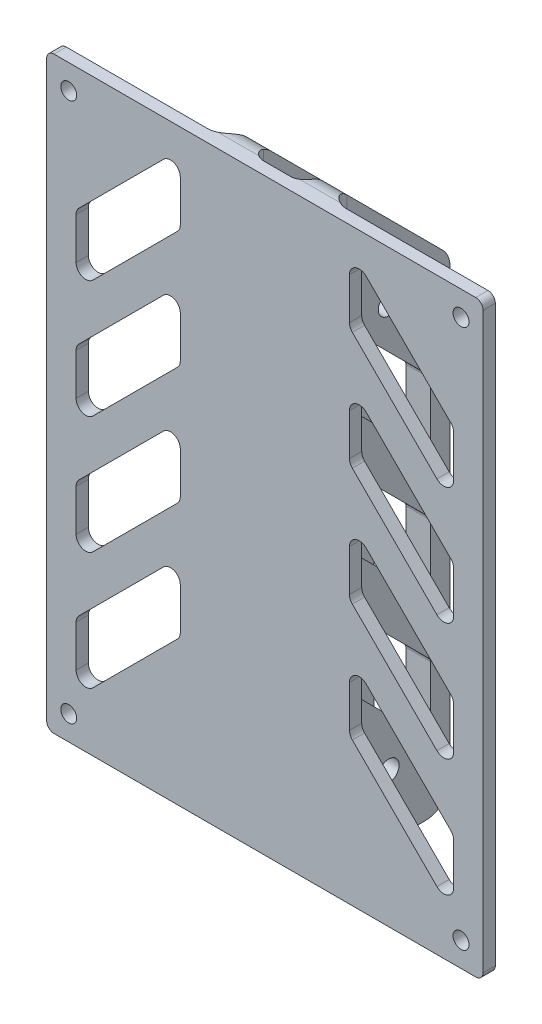
from build123d import *

# Parameters (mm, degrees)
SKETCH1_W               = 178
SKETCH1_H               = 240
BOSS_EXTRUDE1_DEPTH     = 5
SKETCH2_R               = 4.25
BOSS_EXTRUDE2_DEPTH     = 10
FILLET2_R               = 8
FILLET3_R               = 5
FILLET2_OF_MIRROR1_R    = 8
FILLET3_OF_MIRROR1_R    = 5
SKETCH3_R               = 3.25
CUT_EXTRUDE1_DEPTH      = 261.808358867
FILLET4_R               = 3
CUT_EXTRUDE2_DEPTH      = 269.496275682
CUT_EXTRUDE2_DEPTH_BACK = 269.496275682
CUT_EXTRUDE3_DEPTH      = 261.808358867
CUT_EXTRUDE3_DEPTH_BACK = 261.808358867
BOSS_EXTRUDE3_DEPTH     = 6
FILLET5_R               = 3


with BuildPart() as part:
    # Sketch1 → Boss-Extrude1 (new body)
    with BuildSketch(Plane.XY):
        with Locations((0, 120)):
            Rectangle(SKETCH1_W, SKETCH1_H)
    extrude(amount=BOSS_EXTRUDE1_DEPTH)

    # Sketch2 → Boss-Extrude2 (add)
    with BuildSketch(Plane(origin=(10.5, 0, 0), x_dir=(0, 0, -1), z_dir=(1, 0, 0))):
        with BuildLine():
            Line((0, 0), (40, 0))
            ThreePointArc((40, 0), (47.071067812, 2.928932188), (50, 10))
            Line((50, 10), (50, 190.857864376))
            ThreePointArc((50, 190.857864376), (49.238795325, 194.6846987), (47.071067812, 197.928932188))
            Line((47.071067812, 197.928932188), (7.928932188, 237.071067812))
            ThreePointArc((7.928932188, 237.071067812), (4.6846987, 239.238795325), (0.857864376, 240))
            Line((0.857864376, 240), (0, 240))
            Line((0, 240), (0, 0))
        make_face()
        with Locations((25, 190)):
            Circle(SKETCH2_R, mode=Mode.SUBTRACT)
        with Locations((25, 25)):
            Circle(SKETCH2_R, mode=Mode.SUBTRACT)
    boss_extrude2 = extrude(amount=BOSS_EXTRUDE2_DEPTH)

    # Fillet2
    fillet2_edges = [part.edges().sort_by_distance(p)[0] for p in [
        (20.5, 120, 0),
    ]]
    fillet(fillet2_edges, radius=FILLET2_R)

    # Fillet3
    fillet3_edges = [part.edges().sort_by_distance(p)[0] for p in [
        (10.5, 120, 0),
    ]]
    fillet(fillet3_edges, radius=FILLET3_R)

    # Mirror1: Boss-Extrude2 across plane
    add(boss_extrude2.mirror(Plane(origin=(0, 0, 0), x_dir=(0, 0, 1), z_dir=(1, 0, 0))))

    # Fillet2 of Mirror1
    fillet2_of_mirror1_edges = [part.edges().sort_by_distance(p)[0] for p in [
        (-20.5, 120, 0),
    ]]
    fillet(fillet2_of_mirror1_edges, radius=FILLET2_OF_MIRROR1_R)

    # Fillet3 of Mirror1
    fillet3_of_mirror1_edges = [part.edges().sort_by_distance(p)[0] for p in [
        (-10.5, 120, 0),
    ]]
    fillet(fillet3_of_mirror1_edges, radius=FILLET3_OF_MIRROR1_R)

    # Sketch3 → Cut-Extrude1 (cut, through all)
    with BuildSketch(Plane(origin=(0, 0, 0), x_dir=(-1, 0, 0), z_dir=(0, 0, -1))):
        with Locations((-80, 10)):
            Circle(SKETCH3_R)
        with Locations((80, 10)):
            Circle(SKETCH3_R)
        with Locations((80, 230)):
            Circle(SKETCH3_R)
        with Locations((-80, 230)):
            Circle(SKETCH3_R)
    extrude(amount=-CUT_EXTRUDE1_DEPTH, mode=Mode.SUBTRACT)

    # Fillet4
    fillet4_edges = [part.edges().sort_by_distance(p)[0] for p in [
        (89, 240, 2.5),
        (-89, 240, 2.5),
        (-89, 0, 2.5),
        (89, 0, 2.5),
    ]]
    fillet(fillet4_edges, radius=FILLET4_R)

    # Sketch4 → Cut-Extrude2 (cut, two sides: drawn at the far end of the back side and taken through both)
    with BuildSketch(Plane.ZY.offset(20.5).offset(-CUT_EXTRUDE2_DEPTH_BACK)):
        with BuildLine():
            Line((-41.414213562, 156.615223689), (-14.414213562, 183.615223689))
            ThreePointArc((-14.414213562, 183.615223689), (-12.234633135, 184.048769192), (-11, 182.201010127))
            Line((-11, 182.201010127), (-11, 159.573593129))
            ThreePointArc((-11, 159.573593129), (-11.152240935, 158.808226264), (-11.585786438, 158.159379566))
            Line((-11.585786438, 158.159379566), (-38.585786438, 131.159379566))
            ThreePointArc((-38.585786438, 131.159379566), (-40.765366865, 130.725834064), (-42, 132.573593129))
            Line((-42, 132.573593129), (-42, 155.201010127))
            ThreePointArc((-42, 155.201010127), (-41.847759065, 155.966376992), (-41.414213562, 156.615223689))
        make_face()
        with BuildLine():
            Line((-42, 82.573593129), (-42, 105.201010127))
            ThreePointArc((-42, 105.201010127), (-41.847759065, 105.966376992), (-41.414213562, 106.615223689))
            Line((-41.414213562, 106.615223689), (-14.414213562, 133.615223689))
            ThreePointArc((-14.414213562, 133.615223689), (-12.234633135, 134.048769192), (-11, 132.201010127))
            Line((-11, 132.201010127), (-11, 109.573593129))
            ThreePointArc((-11, 109.573593129), (-11.152240935, 108.808226264), (-11.585786438, 108.159379566))
            Line((-11.585786438, 108.159379566), (-38.585786438, 81.159379566))
            ThreePointArc((-38.585786438, 81.159379566), (-40.765366865, 80.725834064), (-42, 82.573593129))
        make_face()
        with BuildLine():
            Line((-42, 32.573593129), (-42, 55.201010127))
            ThreePointArc((-42, 55.201010127), (-41.847759065, 55.966376992), (-41.414213562, 56.615223689))
            Line((-41.414213562, 56.615223689), (-14.414213562, 83.615223689))
            ThreePointArc((-14.414213562, 83.615223689), (-12.234633135, 84.048769192), (-11, 82.201010127))
            Line((-11, 82.201010127), (-11, 59.573593129))
            ThreePointArc((-11, 59.573593129), (-11.152240935, 58.808226264), (-11.585786438, 58.159379566))
            Line((-11.585786438, 58.159379566), (-38.585786438, 31.159379566))
            ThreePointArc((-38.585786438, 31.159379566), (-40.765366865, 30.725834064), (-42, 32.573593129))
        make_face()
    extrude(amount=CUT_EXTRUDE2_DEPTH + CUT_EXTRUDE2_DEPTH_BACK, mode=Mode.SUBTRACT)

    # Sketch5 → Cut-Extrude3 (cut, two sides: drawn at the far end of the back side and taken through both)
    with BuildSketch(Plane(origin=(0, 0, 0), x_dir=(-1, 0, 0), z_dir=(0, 0, -1)).offset(-CUT_EXTRUDE3_DEPTH_BACK)):
        with BuildLine():
            Line((-75.828427125, 190.671572875), (-41.328427125, 225.171572875))
            ThreePointArc((-41.328427125, 225.171572875), (-36.969266271, 226.038663881), (-34.5, 222.343145751))
            Line((-34.5, 222.343145751), (-34.5, 205.372583002))
            ThreePointArc((-34.5, 205.372583002), (-34.80448187, 203.841849273), (-35.671572875, 202.544155877))
            Line((-35.671572875, 202.544155877), (-70.171572875, 168.044155877))
            ThreePointArc((-70.171572875, 168.044155877), (-74.530733729, 167.177064872), (-77, 170.872583002))
            Line((-77, 170.872583002), (-77, 187.843145751))
            ThreePointArc((-77, 187.843145751), (-76.69551813, 189.37387948), (-75.828427125, 190.671572875))
        make_face()
        with BuildLine():
            Line((-75.828427125, 142.671572875), (-41.328427125, 177.171572875))
            ThreePointArc((-41.328427125, 177.171572875), (-36.969266271, 178.038663881), (-34.5, 174.343145751))
            Line((-34.5, 174.343145751), (-34.5, 157.372583002))
            ThreePointArc((-34.5, 157.372583002), (-34.80448187, 155.841849273), (-35.671572875, 154.544155877))
            Line((-35.671572875, 154.544155877), (-70.171572875, 120.044155877))
            ThreePointArc((-70.171572875, 120.044155877), (-74.530733729, 119.177064872), (-77, 122.872583002))
            Line((-77, 122.872583002), (-77, 139.843145751))
            ThreePointArc((-77, 139.843145751), (-76.69551813, 141.37387948), (-75.828427125, 142.671572875))
        make_face()
        with BuildLine():
            Line((-75.828427125, 94.671572875), (-41.328427125, 129.171572875))
            ThreePointArc((-41.328427125, 129.171572875), (-36.969266271, 130.038663881), (-34.5, 126.343145751))
            Line((-34.5, 126.343145751), (-34.5, 109.372583002))
            ThreePointArc((-34.5, 109.372583002), (-34.80448187, 107.841849273), (-35.671572875, 106.544155877))
            Line((-35.671572875, 106.544155877), (-70.171572875, 72.044155877))
            ThreePointArc((-70.171572875, 72.044155877), (-74.530733729, 71.177064872), (-77, 74.872583002))
            Line((-77, 74.872583002), (-77, 91.843145751))
            ThreePointArc((-77, 91.843145751), (-76.69551813, 93.37387948), (-75.828427125, 94.671572875))
        make_face()
        with BuildLine():
            Line((-75.828427125, 46.671572875), (-41.328427125, 81.171572875))
            ThreePointArc((-41.328427125, 81.171572875), (-36.969266271, 82.038663881), (-34.5, 78.343145751))
            Line((-34.5, 78.343145751), (-34.5, 61.372583002))
            ThreePointArc((-34.5, 61.372583002), (-34.80448187, 59.841849273), (-35.671572875, 58.544155877))
            Line((-35.671572875, 58.544155877), (-70.171572875, 24.044155877))
            ThreePointArc((-70.171572875, 24.044155877), (-74.530733729, 23.177064872), (-77, 26.872583002))
            Line((-77, 26.872583002), (-77, 43.843145751))
            ThreePointArc((-77, 43.843145751), (-76.69551813, 45.37387948), (-75.828427125, 46.671572875))
        make_face()
        with BuildLine():
            Line((77, 43.843145751), (77, 26.872583002))
            ThreePointArc((77, 26.872583002), (74.530733729, 23.177064872), (70.171572875, 24.044155877))
            Line((70.171572875, 24.044155877), (35.671572875, 58.544155877))
            ThreePointArc((35.671572875, 58.544155877), (34.80448187, 59.841849273), (34.5, 61.372583002))
            Line((34.5, 61.372583002), (34.5, 78.343145751))
            ThreePointArc((34.5, 78.343145751), (36.969266271, 82.038663881), (41.328427125, 81.171572875))
            Line((41.328427125, 81.171572875), (75.828427125, 46.671572875))
            ThreePointArc((75.828427125, 46.671572875), (76.69551813, 45.37387948), (77, 43.843145751))
        make_face()
        with BuildLine():
            Line((77, 91.843145751), (77, 74.872583002))
            ThreePointArc((77, 74.872583002), (74.530733729, 71.177064872), (70.171572875, 72.044155877))
            Line((70.171572875, 72.044155877), (35.671572875, 106.544155877))
            ThreePointArc((35.671572875, 106.544155877), (34.80448187, 107.841849273), (34.5, 109.372583002))
            Line((34.5, 109.372583002), (34.5, 126.343145751))
            ThreePointArc((34.5, 126.343145751), (36.969266271, 130.038663881), (41.328427125, 129.171572875))
            Line((41.328427125, 129.171572875), (75.828427125, 94.671572875))
            ThreePointArc((75.828427125, 94.671572875), (76.69551813, 93.37387948), (77, 91.843145751))
        make_face()
        with BuildLine():
            Line((77, 139.843145751), (77, 122.872583002))
            ThreePointArc((77, 122.872583002), (74.530733729, 119.177064872), (70.171572875, 120.044155877))
            Line((70.171572875, 120.044155877), (35.671572875, 154.544155877))
            ThreePointArc((35.671572875, 154.544155877), (34.80448187, 155.841849273), (34.5, 157.372583002))
            Line((34.5, 157.372583002), (34.5, 174.343145751))
            ThreePointArc((34.5, 174.343145751), (36.969266271, 178.038663881), (41.328427125, 177.171572875))
            Line((41.328427125, 177.171572875), (75.828427125, 142.671572875))
            ThreePointArc((75.828427125, 142.671572875), (76.69551813, 141.37387948), (77, 139.843145751))
        make_face()
        with BuildLine():
            Line((77, 187.843145751), (77, 170.872583002))
            ThreePointArc((77, 170.872583002), (74.530733729, 167.177064872), (70.171572875, 168.044155877))
            Line((70.171572875, 168.044155877), (35.671572875, 202.544155877))
            ThreePointArc((35.671572875, 202.544155877), (34.80448187, 203.841849273), (34.5, 205.372583002))
            Line((34.5, 205.372583002), (34.5, 222.343145751))
            ThreePointArc((34.5, 222.343145751), (36.969266271, 226.038663881), (41.328427125, 225.171572875))
            Line((41.328427125, 225.171572875), (75.828427125, 190.671572875))
            ThreePointArc((75.828427125, 190.671572875), (76.69551813, 189.37387948), (77, 187.843145751))
        make_face()
    extrude(amount=CUT_EXTRUDE3_DEPTH + CUT_EXTRUDE3_DEPTH_BACK, mode=Mode.SUBTRACT)

    # Sketch8 → Boss-Extrude3 (add)
    with BuildSketch(Plane(origin=(0, 5, 0), x_dir=(-1, 0, 0), z_dir=(0, -1, 0))):
        with BuildLine():
            Line((-48.328427125, 0), (-20.5, 27.828427125))
            Line((-20.5, 27.828427125), (-20.5, 8))
            ThreePointArc((-20.5, 8), (-22.843145751, 2.343145751), (-28.5, 0))
            Line((-28.5, 0), (-48.328427125, 0))
        make_face()
    boss_extrude3 = extrude(amount=-BOSS_EXTRUDE3_DEPTH)

    # Mirror3: Boss-Extrude3 across plane
    add(boss_extrude3.mirror(Plane(origin=(0, 0, 0), x_dir=(0, 0, 1), z_dir=(1, 0, 0))))

    # Fillet5
    fillet5_edges = [part.edges().sort_by_distance(p)[0] for p in [
        (38.414213562, 11, 0),
        (20.5, 11, -17.914213562),
        (20.5, 5, -17.914213562),
        (22.843145751, 5, -2.343145751),
        (22.843145751, 11, -2.343145751),
        (38.414213562, 5, 0),
        (-38.414213562, 11, 0),
        (-22.843145751, 11, -2.343145751),
        (-38.414213562, 5, 0),
        (-20.5, 5, -17.914213562),
        (-20.5, 11, -17.914213562),
        (-20.5, 8, -27.828427125),
        (-48.328427125, 8, 0),
        (-22.843145751, 5, -2.343145751),
        (20.5, 8, -27.828427125),
        (48.328427125, 8, 0),
    ]]
    fillet(fillet5_edges, radius=FILLET5_R)


solid = part.part
